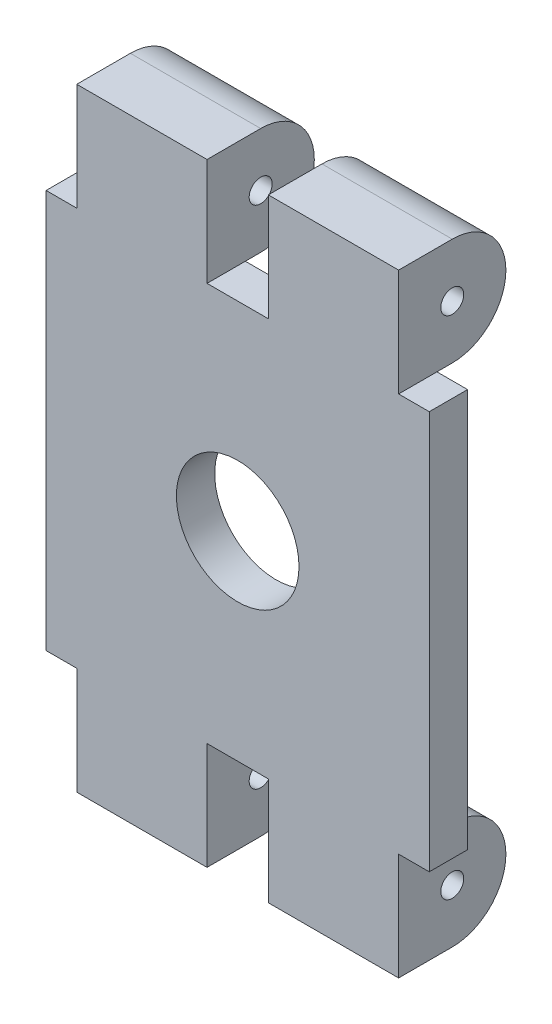
from build123d import *

# Parameters (mm, degrees)
SKETCH_1_W          = 50
SKETCH_1_H          = 80
EXTRUDE_1_DEPTH     = 5
EXTRUDE_2_DEPTH     = 50
SKETCH_4_W          = 4
SKETCH_4_H          = 14
SKETCH_4_W_2        = 8
CUT_EXTRUDE_1_DEPTH = 50
SKETCH_5_R          = 1.5
CUT_EXTRUDE_2_DEPTH = 50
SKETCH_6_R          = 8
CUT_EXTRUDE_3_DEPTH = 50


with BuildPart() as part:
    # 草图1 → 凸台-拉伸1 (new body)
    with BuildSketch(Plane.XY):
        Rectangle(SKETCH_1_W, SKETCH_1_H)
    extrude(amount=EXTRUDE_1_DEPTH)

    # 草图3 → 凸台-拉伸2 (add)
    with BuildSketch(Plane.ZY.offset(25)):
        with BuildLine():
            Line((5, 40), (-2, 40))
            ThreePointArc((-2, 40), (-9, 33), (-2, 26))
            Line((-2, 26), (5, 26))
            Line((5, 26), (5, 40))
        make_face()
        with BuildLine():
            Line((5, -26), (5, -40))
            Line((5, -40), (-2, -40))
            ThreePointArc((-2, -40), (-9, -33), (-2, -26))
            Line((-2, -26), (5, -26))
        make_face()
    extrude(amount=-EXTRUDE_2_DEPTH)

    # 草图4 → 切除-拉伸1 (cut)
    with BuildSketch(Plane.XY.offset(5)):
        with Locations((-23, 33)):
            Rectangle(SKETCH_4_W, SKETCH_4_H)
        with Locations((0, 33)):
            Rectangle(SKETCH_4_W_2, SKETCH_4_H)
        with Locations((23, 33)):
            Rectangle(SKETCH_4_W, SKETCH_4_H)
        with Locations((23, -33)):
            Rectangle(SKETCH_4_W, SKETCH_4_H)
        with Locations((0, -33)):
            Rectangle(SKETCH_4_W_2, SKETCH_4_H)
        with Locations((-23, -33)):
            Rectangle(SKETCH_4_W, SKETCH_4_H)
    extrude(amount=-CUT_EXTRUDE_1_DEPTH, mode=Mode.SUBTRACT)

    # 草图5 → 切除-拉伸2 (cut)
    with BuildSketch(Plane.ZY.offset(25)):
        with Locations((-2, 33)):
            Circle(SKETCH_5_R)
        with Locations((-2, -33)):
            Circle(SKETCH_5_R)
    extrude(amount=-CUT_EXTRUDE_2_DEPTH, mode=Mode.SUBTRACT)

    # 草图6 → 切除-拉伸3 (cut)
    with BuildSketch(Plane.XY.offset(5)):
        Circle(SKETCH_6_R)
    extrude(amount=-CUT_EXTRUDE_3_DEPTH, mode=Mode.SUBTRACT)


solid = part.part
